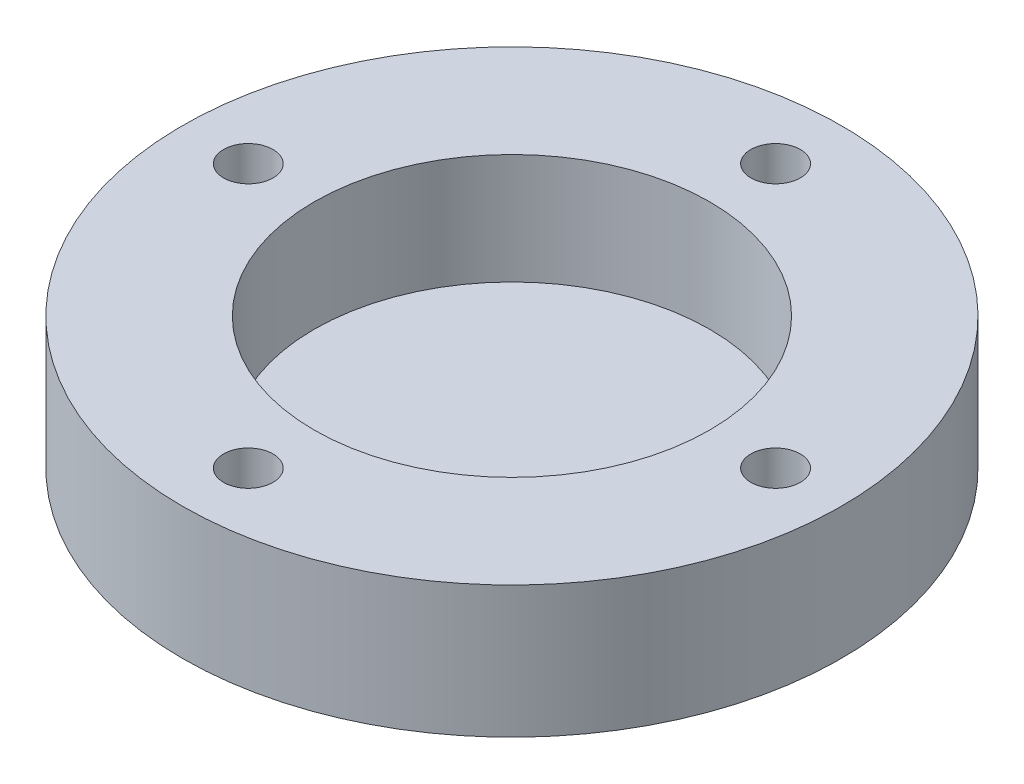
from build123d import *

# Parameters (mm, degrees)
SKETCH2_R           = 20
BOSS_EXTRUDE1_DEPTH = 8
SKETCH3_R           = 1.5
CUT_EXTRUDE1_DEPTH  = 30.393876913
SKETCH4_R           = 12
CUT_EXTRUDE2_DEPTH  = 6.7


with BuildPart() as part:
    # Sketch2 → Boss-Extrude1 (new body)
    with BuildSketch(Plane(origin=(0, 0, 0), x_dir=(1, 0, 0), z_dir=(0, 1, 0))):
        Circle(SKETCH2_R)
    extrude(amount=BOSS_EXTRUDE1_DEPTH)

    # Sketch3 → Cut-Extrude1 (cut, through all)
    with BuildSketch(Plane(origin=(0, 8, 0), x_dir=(1, 0, 0), z_dir=(0, 1, 0))):
        with Locations((0, 16)):
            Circle(SKETCH3_R)
        with Locations((-16, 0)):
            Circle(SKETCH3_R)
        with Locations((16, 0)):
            Circle(SKETCH3_R)
        with Locations((0, -16)):
            Circle(SKETCH3_R)
    extrude(amount=-CUT_EXTRUDE1_DEPTH, mode=Mode.SUBTRACT)

    # Sketch4 → Cut-Extrude2 (cut)
    with BuildSketch(Plane(origin=(0, 8, -8), x_dir=(1, 0, 0), z_dir=(0, -1, 0))):
        with Locations((0, 8)):
            Circle(SKETCH4_R)
    extrude(amount=CUT_EXTRUDE2_DEPTH, mode=Mode.SUBTRACT)


solid = part.part
